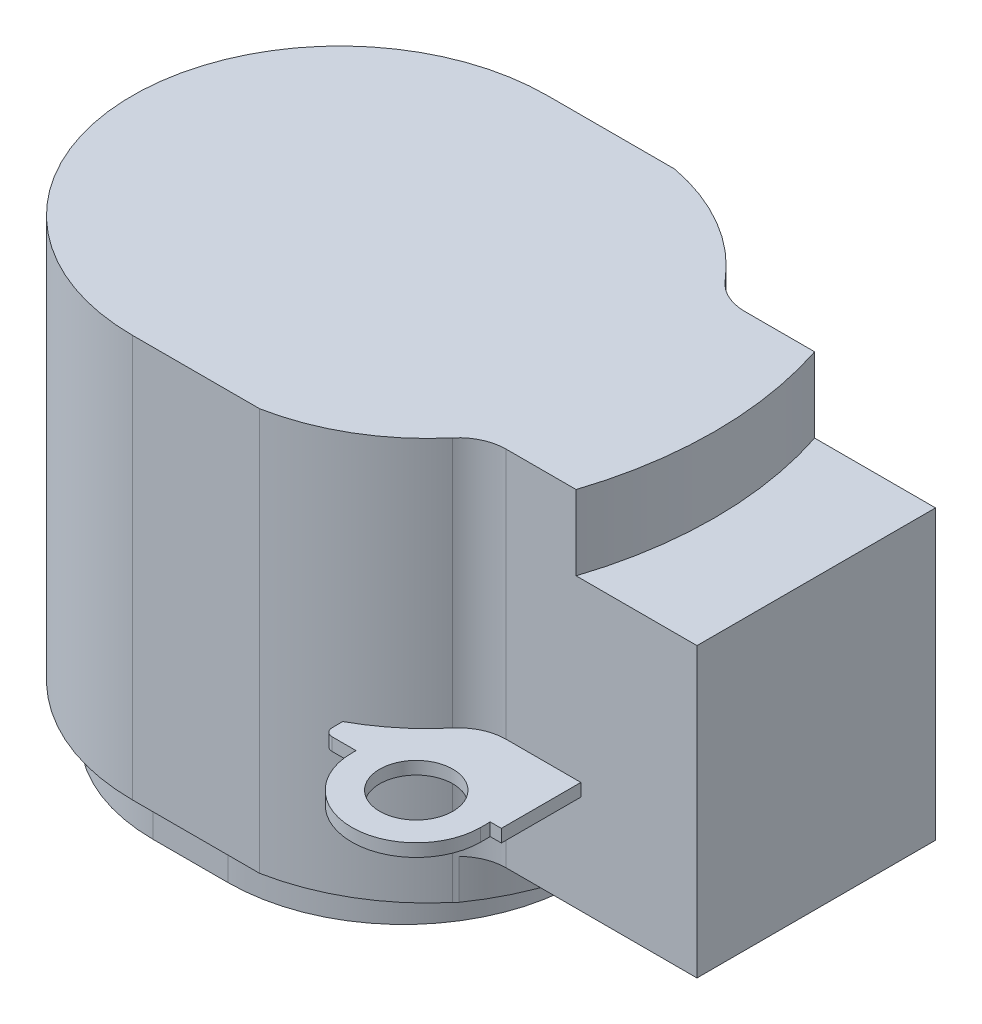
from build123d import *

# Parameters (mm, degrees)
BOSS_EXTRUDE1_DEPTH = 28.8
CUT_EXTRUDE1_DEPTH  = 41.90409515
BOSS_EXTRUDE3_DEPTH = 1
CUT_EXTRUDE2_DEPTH  = 4.7
SKETCH4_R           = 2.3
BOSS_EXTRUDE2_DEPTH = 0.8
SKETCH5_OUTSIDE_W   = 57.418
SKETCH5_OUTSIDE_H   = 48.718
CUT_EXTRUDE3_DEPTH  = 3.5
SKETCH6_OUTSIDE_W   = 57.418
SKETCH6_OUTSIDE_H   = 48.718
CUT_EXTRUDE4_DEPTH  = 2.5
SKETCH8_W           = 6.84
SKETCH8_H           = 6
BOSS_EXTRUDE4_DEPTH = 25


with BuildPart() as part:
    # Sketch1 → Boss-Extrude1 (new body)
    with BuildSketch(Plane(origin=(0, 0, 0), x_dir=(1, 0, 0), z_dir=(0, 1, 0))):
        with BuildLine():
            Line((-4, 13.05), (4, 13.05))
            ThreePointArc((4, 13.05), (8.213640499, 11.465985784), (11.656602829, 8.566006872))
            ThreePointArc((11.656602829, 8.566006872), (12.685480206, 7.779523995), (13.95, 7.5))
            Line((13.95, 7.5), (25.95, 7.5))
            Line((25.95, 7.5), (25.95, -7.5))
            Line((25.95, -7.5), (13.95, -7.5))
            ThreePointArc((13.95, -7.5), (12.685480206, -7.779523995), (11.656602829, -8.566006872))
            ThreePointArc((11.656602829, -8.566006872), (8.213640499, -11.465985784), (4, -13.05))
            Line((4, -13.05), (-4, -13.05))
            ThreePointArc((-4, -13.05), (-17.05, 0), (-4, 13.05))
        make_face()
    extrude(amount=-BOSS_EXTRUDE1_DEPTH)

    # Sketch2 → Cut-Extrude1 (cut, through all)
    with BuildSketch(Plane(origin=(0, 0, 0), x_dir=(1, 0, 0), z_dir=(0, 1, 0))):
        with BuildLine():
            Line((0, -9.05), (-4.7, -9.05))
            ThreePointArc((-4.7, -9.05), (-13.75, 0), (-4.7, 9.05))
            Line((-4.7, 9.05), (0, 9.05))
            ThreePointArc((0, 9.05), (9.05, 0), (0, -9.05))
        make_face()
    extrude(amount=-CUT_EXTRUDE1_DEPTH, mode=Mode.SUBTRACT)

    # Sketch7 → Boss-Extrude3 (add)
    with BuildSketch(Plane(origin=(0, 0, 0), x_dir=(1, 0, 0), z_dir=(0, 1, 0))):
        with BuildLine():
            Line((-4.7, 10.05), (0, 10.05))
            ThreePointArc((0, 10.05), (10.05, 0), (0, -10.05))
            Line((0, -10.05), (-4.7, -10.05))
            ThreePointArc((-4.7, -10.05), (-14.75, 0), (-4.7, 10.05))
        make_face()
    extrude(amount=-BOSS_EXTRUDE3_DEPTH)

    # Sketch3 → Cut-Extrude2 (cut)
    with BuildSketch(Plane(origin=(0, 0, 0), x_dir=(1, 0, 0), z_dir=(0, 1, 0))):
        with BuildLine():
            Line((25.95, 7.5), (18.35, 7.5))
            ThreePointArc((18.35, 7.5), (19.55, 0), (18.35, -7.5))
            Line((18.35, -7.5), (25.95, -7.5))
            Line((25.95, -7.5), (25.95, 7.5))
        make_face()
    extrude(amount=-CUT_EXTRUDE2_DEPTH, mode=Mode.SUBTRACT)

    # Sketch4 → Boss-Extrude2 (add)
    with BuildSketch(Plane(origin=(0, -15.8, 0), x_dir=(1, 0, 0), z_dir=(0, 1, 0))):
        with BuildLine():
            Line((17.95, 12.5), (17.95, 13.1))
            ThreePointArc((17.95, 13.1), (13.9, 17.15), (9.85, 13.1))
            Line((9.85, 13.1), (9.85, 12.835141167))
            Line((9.85, 12.835141167), (8.35, 12.835141167))
            ThreePointArc((8.35, 12.835141167), (7.996446609, 12.688694558), (7.85, 12.335141167))
            Line((7.85, 12.335141167), (7.85, 10.106704765))
            Line((7.85, 10.106704765), (9.85, 10.106704765))
            Line((9.85, 10.106704765), (9.85, -10.106704765))
            Line((9.85, -10.106704765), (7.85, -10.106704765))
            Line((7.85, -10.106704765), (7.85, -12.335141167))
            ThreePointArc((7.85, -12.335141167), (7.996446609, -12.688694558), (8.35, -12.835141167))
            Line((8.35, -12.835141167), (9.85, -12.835141167))
            Line((9.85, -12.835141167), (9.85, -13.1))
            ThreePointArc((9.85, -13.1), (13.9, -17.15), (17.95, -13.1))
            Line((17.95, -13.1), (17.95, -12.5))
            Line((17.95, -12.5), (18.65, -12.5))
            Line((18.65, -12.5), (18.65, -6.668963251))
            Line((18.65, -6.668963251), (17.95, -6.668963251))
            Line((17.95, -6.668963251), (17.95, 6.668963251))
            Line((17.95, 6.668963251), (18.65, 6.668963251))
            Line((18.65, 6.668963251), (18.65, 12.5))
            Line((18.65, 12.5), (17.95, 12.5))
        make_face()
        with Locations((13.9, -13.1)):
            Circle(SKETCH4_R, mode=Mode.SUBTRACT)
        with Locations((13.9, 13.1)):
            Circle(SKETCH4_R, mode=Mode.SUBTRACT)
    extrude(amount=-BOSS_EXTRUDE2_DEPTH)

    # Sketch5 outside → Cut-Extrude3 (cut)
    # profile 1 of 2: a face of its own
    with BuildSketch(Plane.XZ.offset(28.8)):
        with Locations((4.45, 0)):
            Rectangle(SKETCH5_OUTSIDE_W, SKETCH5_OUTSIDE_H)
        with BuildLine():
            Line((0, 11.05), (-4.7, 11.05))
            ThreePointArc((-4.7, 11.05), (-15.75, 0), (-4.7, -11.05))
            Line((-4.7, -11.05), (0, -11.05))
            ThreePointArc((0, -11.05), (11.05, 0), (0, 11.05))
        make_face(mode=Mode.SUBTRACT)
    # profile 2 of 2: a face of its own
    with BuildSketch(Plane.XZ.offset(28.8)):
        with BuildLine():
            Line((-4.7, 9.05), (0, 9.05))
            ThreePointArc((0, 9.05), (9.05, 0), (0, -9.05))
            Line((0, -9.05), (-4.7, -9.05))
            ThreePointArc((-4.7, -9.05), (-13.75, 0), (-4.7, 9.05))
        make_face()
    extrude(amount=-CUT_EXTRUDE3_DEPTH, mode=Mode.SUBTRACT)

    # Sketch6 outside → Cut-Extrude4 (cut)
    with BuildSketch(Plane.XZ.offset(25.3)):
        with Locations((4.45, 0)):
            Rectangle(SKETCH6_OUTSIDE_W, SKETCH6_OUTSIDE_H)
        with BuildLine():
            Line((-0.915214063, 14.471830711), (-20.749472671, 14.471830711))
            Line((-20.749472671, 14.471830711), (-20.749472671, -14.500741391))
            Line((-20.749472671, -14.500741391), (0, -14.500741391))
            ThreePointArc((0, -14.500741391), (14.493511919, 0.457835289), (-0.915214063, 14.471830711))
        make_face(mode=Mode.SUBTRACT)
    extrude(amount=-CUT_EXTRUDE4_DEPTH, mode=Mode.SUBTRACT)

    # Sketch8 → Boss-Extrude4 (add)
    with BuildSketch(Plane(origin=(25.95, 0, 0), x_dir=(0, 0, -1), z_dir=(1, 0, 0))):
        with Locations((0, -18.98)):
            Rectangle(SKETCH8_W, SKETCH8_H)
        with Locations((0, -8.03)):
            Rectangle(SKETCH8_W, SKETCH8_H)
    extrude(amount=-BOSS_EXTRUDE4_DEPTH)


solid = part.part
